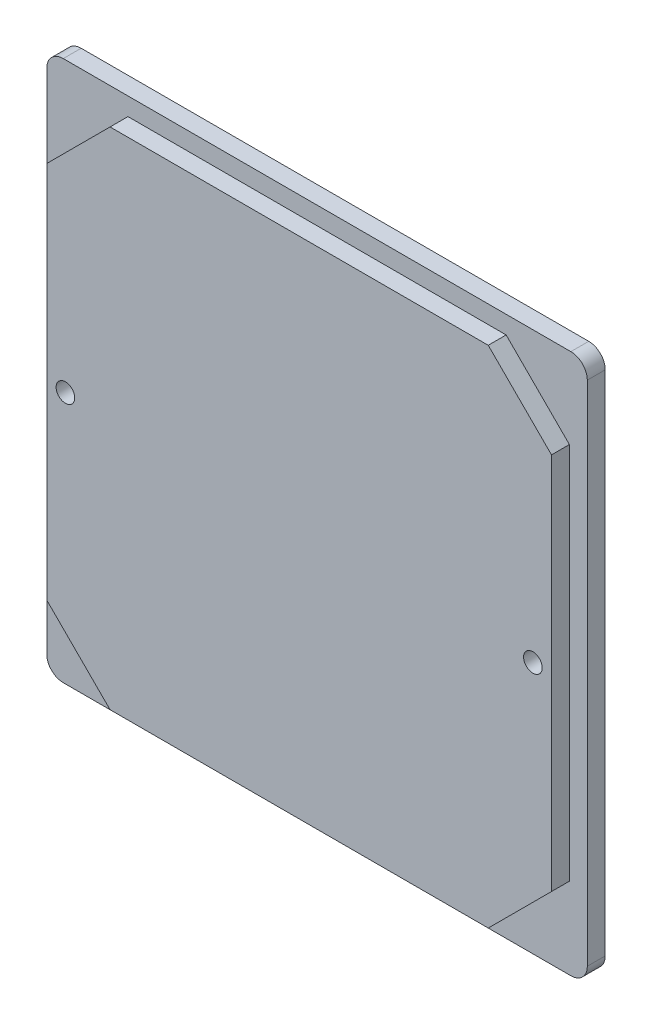
from build123d import *

# Parameters (mm, degrees)
SKETCH_1_W          = 75.5
SKETCH_1_H          = 75.5
SKETCH_1_R          = 1.3
EXTRUDE_1_DEPTH     = 5
FILLET_1_R          = 2.3
CUT_EXTRUDE_1_DEPTH = 2.5


with BuildPart() as part:
    # 草图1 → 凸台-拉伸1 (new body)
    with BuildSketch(Plane.XY):
        Rectangle(SKETCH_1_W, SKETCH_1_H)
        with Locations((-32.65, 0)):
            Circle(SKETCH_1_R, mode=Mode.SUBTRACT)
        with Locations((32.65, 0)):
            Circle(SKETCH_1_R, mode=Mode.SUBTRACT)
    extrude(amount=EXTRUDE_1_DEPTH)

    # 圆角1
    fillet_1_edges = [part.edges().sort_by_distance(p)[0] for p in [
        (37.75, -37.75, 2.5),
        (-37.75, -37.75, 2.5),
        (37.75, 37.75, 2.5),
        (-37.75, 37.75, 2.5),
    ]]
    fillet(fillet_1_edges, radius=FILLET_1_R)

    # 草图2 → 切除-拉伸1 (cut)
    with BuildSketch(Plane.XY.offset(5)):
        with BuildLine():
            Line((-35.45, -37.75), (35.45, -37.75))
            ThreePointArc((35.45, -37.75), (37.076345597, -37.076345597), (37.75, -35.45))
            Line((37.75, -35.45), (37.75, 35.45))
            ThreePointArc((37.75, 35.45), (37.076345597, 37.076345597), (35.45, 37.75))
            Line((35.45, 37.75), (-35.45, 37.75))
            ThreePointArc((-35.45, 37.75), (-37.076345597, 37.076345597), (-37.75, 35.45))
            Line((-37.75, 35.45), (-37.75, -35.45))
            ThreePointArc((-37.75, -35.45), (-37.076345597, -37.076345597), (-35.45, -37.75))
        make_face()
        Polygon((-26.411165235, 35.25), (26.411165235, 35.25), (35.25, 26.411165235), (35.25, -26.411165235), (26.411165235, -35.25), (-26.411165235, -35.25), (-35.25, -26.411165235), (-35.25, 26.411165235), align=None, mode=Mode.SUBTRACT)
    extrude(amount=-CUT_EXTRUDE_1_DEPTH, mode=Mode.SUBTRACT)


solid = part.part
